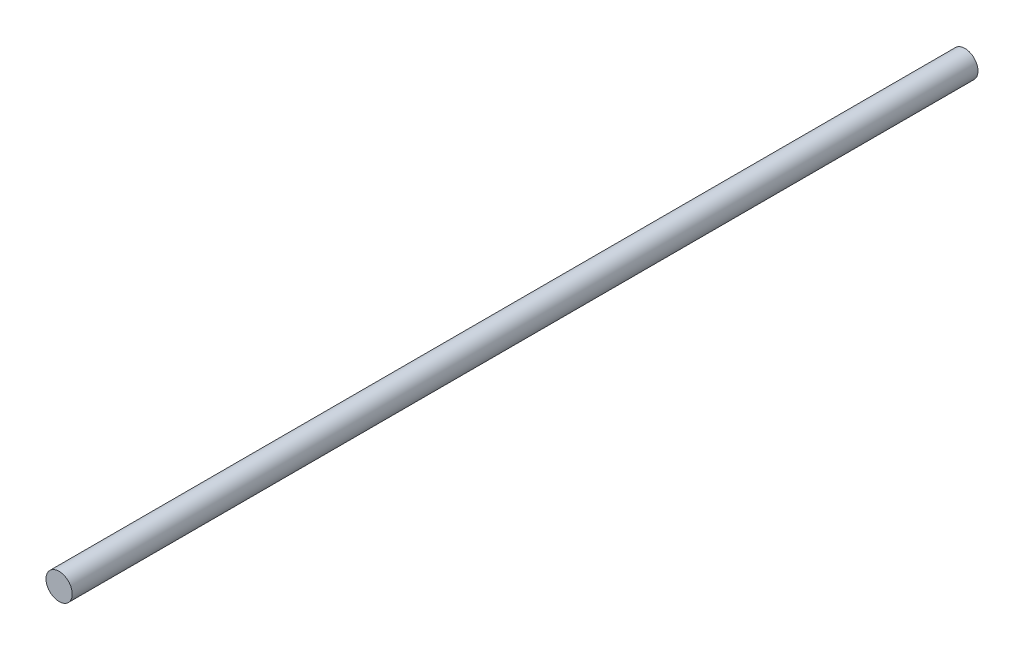
from build123d import *

# Parameters (mm, degrees)
SKETCH1_R           = 6.35
BOSS_EXTRUDE1_DEPTH = 438.15


with BuildPart() as part:
    # Sketch1 → Boss-Extrude1 (new body)
    with BuildSketch(Plane.XY):
        Circle(SKETCH1_R)
    extrude(amount=BOSS_EXTRUDE1_DEPTH)


solid = part.part
